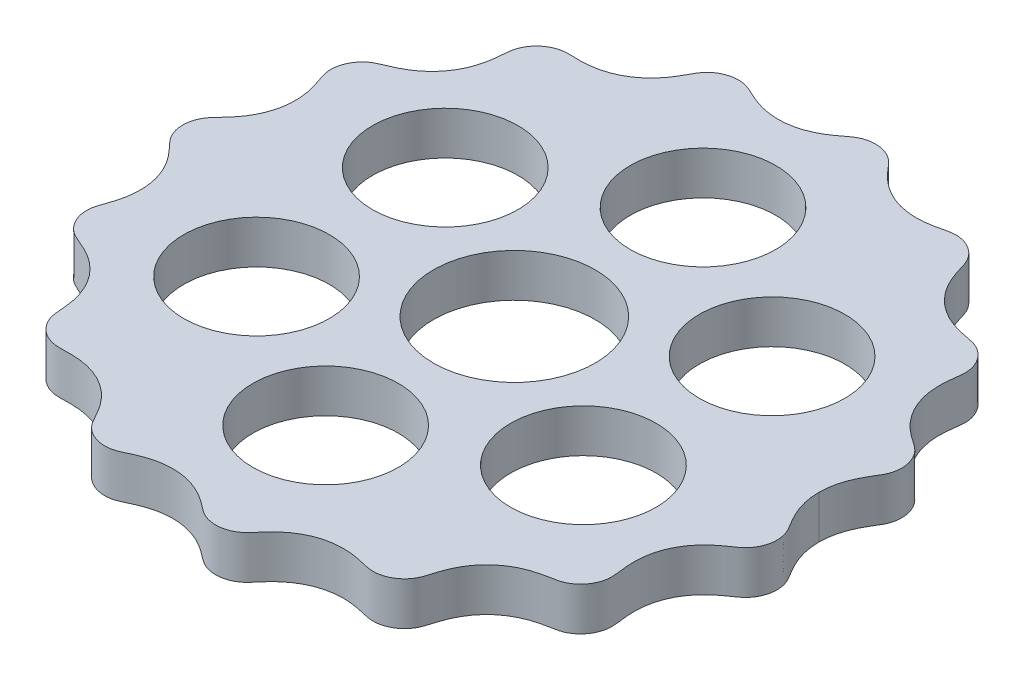
from build123d import *

# Parameters (mm, degrees)
SKETCH3_R           = 6.75
SKETCH3_R_2         = 7.5
BOSS_EXTRUDE1_DEPTH = 4


with BuildPart() as part:
    # Sketch3 → Boss-Extrude1 (new body)
    with BuildSketch(Plane(origin=(0, 0, 0), x_dir=(1, 0, 0), z_dir=(0, 1, 0))):
        with BuildLine():
            add(Edge.make_bspline(
                [(-29.5, 0), (-29.5, -0.020506856), (-29.499508775, -0.061726851), (-29.497298265, -0.132392574), (-29.491402713, -0.233802562), (-29.480345975, -0.355378471), (-29.461173363, -0.493251706), (-29.4301833, -0.65550882), (-29.382904352, -0.838786396), (-29.323765371, -1.017900193), (-29.252718115, -1.193085775), (-29.124632087, -1.45558278), (-28.90921809, -1.789990126), (-28.572215157, -2.159464513), (-28.153637798, -2.591986094), (-27.793312582, -3.00332682), (-27.494220956, -3.391733715), (-27.198539155, -3.829853606), (-26.916327948, -4.321772504), (-26.643471264, -4.925378903), (-26.417456605, -5.641378167), (-26.279232637, -6.372836761), (-26.22782757, -7.109204715), (-26.260469314, -7.840015999), (-26.36609006, -8.521461383), (-26.524712227, -9.148060531), (-26.7122212, -9.722867749), (-26.906402138, -10.249106449), (-27.084026477, -10.828826935), (-27.128243584, -11.480242215), (-27.007624154, -12.169804958), (-26.704339817, -12.853660239), (-26.26540634, -13.416119), (-25.727125692, -13.831132821), (-25.147809675, -14.089945054), (-24.599023965, -14.309950779), (-24.022947843, -14.572402127), (-23.433895979, -14.896684969), (-22.846116736, -15.301115548), (-22.2782997, -15.795828927), (-21.775456582, -16.351104338), (-21.344557209, -16.958202197), (-20.98980086, -17.607953023), (-20.713792994, -18.28975274), (-20.525586467, -18.958866797), (-20.409546628, -19.601777164), (-20.343616085, -20.211251037), (-20.305698303, -20.780679307), (-20.23664741, -21.391293307), (-20.015074466, -22.012995768), (-19.625837334, -22.598145566), (-19.074505483, -23.101552224), (-18.450372779, -23.438648125), (-17.79766419, -23.604101232), (-17.168808068, -23.610430078), (-16.583442648, -23.587314002), (-15.956229893, -23.590396394), (-15.292028768, -23.642107021), (-14.595998502, -23.765832809), (-13.88061938, -23.977927385), (-13.194493936, -24.272282169), (-12.548165998, -24.645439778), (-11.950184555, -25.092464451), (-11.408815704, -25.605953656), (-10.953650895, -26.146870654), (-10.576767616, -26.696230387), (-10.260491808, -27.237871371), (-9.987828208, -27.756370733), (-9.667919205, -28.297811687), (-9.198278317, -28.780347353), (-8.594278351, -29.15231418), (-7.882649472, -29.378078239), (-7.181276314, -29.422592585), (-6.532079721, -29.303629152), (-5.968747032, -29.058121981), (-5.456648804, -28.806245606), (-4.895863657, -28.558606199), (-4.281067062, -28.337644457), (-3.607493969, -28.166079072), (-2.879034252, -28.064209022), (-2.138955211, -28.046561644), (-1.397743593, -28.116182477), (-0.66543903, -28.274019755), (0.046903188, -28.518406928), (0.691041037, -28.825223584), (1.266402425, -29.173215737), (1.781732794, -29.540887108), (2.246651709, -29.906145821), (2.760454369, -30.27844327), (3.38899707, -30.537099289), (4.095583639, -30.636000314), (4.839435928, -30.556720046), (5.496965868, -30.316405455), (6.038931991, -29.952392783), (6.45228992, -29.50872604), (6.810708629, -29.077401095), (7.154069437, -28.695657759), (7.481579097, -28.367944206), (7.791280828, -28.092219953), (8.075855138, -27.863479964), (8.446794063, -27.597140689), (8.914400316, -27.31099678), (9.495575967, -27.027420956), (10.198128539, -26.78142275), (10.931287881, -26.619125576), (11.684458703, -26.544316545), (12.403190484, -26.556062439), (13.077925596, -26.635361227), (13.707268128, -26.76047143), (14.290611017, -26.906273022), (14.918614525, -27.044392858), (15.605165751, -27.030879963), (16.302610967, -26.834433706), (16.962995745, -26.453160111), (17.481845811, -25.947378552), (17.836824154, -25.359563266), (18.031210068, -24.746637991), (18.196614764, -24.168544426), (18.402935315, -23.560968071), (18.671631778, -22.936971669), (19.020819266, -22.308674205), (19.462201082, -21.693788885), (19.969318303, -21.140042744), (20.533661927, -20.654546757), (21.145635648, -20.241997885), (21.713789444, -19.946736544), (22.221250647, -19.739640946), (22.701549759, -19.580730556), (23.149147383, -19.460869188), (23.651405896, -19.354435046), (24.20416515, -19.259668921), (24.795065003, -19.123538297), (25.381295585, -18.836179949), (25.918177073, -18.386904665), (26.35876322, -17.782346644), (26.62640489, -17.120976223), (26.716674088, -16.447312982), (26.651155977, -15.816199005), (26.567292453, -15.230937345), (26.50654453, -14.600813106), (26.492855654, -13.928538721), (26.549212855, -13.217291653), (26.693739537, -12.478190143), (26.923199049, -11.765079402), (27.233514149, -11.088357289), (27.618832314, -10.456259632), (28.071291676, -9.87632012), (28.55664588, -9.3787878), (29.055422495, -8.956812811), (29.550245165, -8.59502081), (30.024477359, -8.2774), (30.518681828, -7.912396516), (30.946423484, -7.409498164), (31.248335855, -6.800339452), (31.405725242, -6.117189546), (31.406093828, -5.378461077), (31.237194706, -4.727278247), (30.934069136, -4.194030434), (30.612620381, -3.677587615), (30.33495462, -3.200835277), (30.102039584, -2.734864508), (29.915742198, -2.279302585), (29.785086374, -1.891206047), (29.695940045, -1.57589139), (29.625712231, -1.26893095), (29.572667516, -0.972896461), (29.539534103, -0.719877503), (29.520033852, -0.516003517), (29.508769472, -0.345716178), (29.502757018, -0.199994007), (29.500501274, -0.089793684), (29.5, -0.029889461), (29.5, 0.029889461), (29.500501274, 0.089793684), (29.502757018, 0.199994007), (29.508769472, 0.345716178), (29.520033852, 0.516003517), (29.539534103, 0.719877503), (29.572667516, 0.972896461), (29.625712231, 1.26893095), (29.695940045, 1.57589139), (29.785086374, 1.891206047), (29.915742198, 2.279302585), (30.102039584, 2.734864508), (30.33495462, 3.200835277), (30.612620381, 3.677587615), (30.934069136, 4.194030434), (31.237194706, 4.727278247), (31.406093828, 5.378461077), (31.405725242, 6.117189546), (31.248335855, 6.800339452), (30.946423484, 7.409498164), (30.518681828, 7.912396516), (30.024477359, 8.2774), (29.550245165, 8.59502081), (29.055422495, 8.956812811), (28.55664588, 9.3787878), (28.071291676, 9.87632012), (27.618832314, 10.456259632), (27.233514149, 11.088357289), (26.923199049, 11.765079402), (26.693739537, 12.478190143), (26.549212855, 13.217291653), (26.492855654, 13.928538721), (26.50654453, 14.600813106), (26.567292453, 15.230937345), (26.651155977, 15.816199005), (26.716674088, 16.447312982), (26.62640489, 17.120976223), (26.35876322, 17.782346644), (25.918177073, 18.386904665), (25.381295585, 18.836179949), (24.795065003, 19.123538297), (24.20416515, 19.259668921), (23.651405896, 19.354435046), (23.149147383, 19.460869188), (22.701549759, 19.580730556), (22.221250647, 19.739640946), (21.713789444, 19.946736544), (21.145635648, 20.241997885), (20.533661927, 20.654546757), (19.969318303, 21.140042744), (19.462201082, 21.693788885), (19.020819266, 22.308674205), (18.671631778, 22.936971669), (18.402935315, 23.560968071), (18.196614764, 24.168544426), (18.031210068, 24.746637991), (17.836824154, 25.359563266), (17.481845811, 25.947378552), (16.962995745, 26.453160111), (16.302610967, 26.834433706), (15.605165751, 27.030879963), (14.918614525, 27.044392858), (14.290611017, 26.906273022), (13.707268128, 26.76047143), (13.077925596, 26.635361227), (12.403190484, 26.556062439), (11.684458703, 26.544316545), (10.931287881, 26.619125576), (10.198128539, 26.78142275), (9.495575967, 27.027420956), (8.914400316, 27.31099678), (8.446794063, 27.597140689), (8.075855138, 27.863479964), (7.791280828, 28.092219953), (7.481579097, 28.367944206), (7.154069437, 28.695657759), (6.810708629, 29.077401095), (6.45228992, 29.50872604), (6.038931991, 29.952392783), (5.496965868, 30.316405455), (4.839435928, 30.556720046), (4.095583639, 30.636000314), (3.38899707, 30.537099289), (2.760454369, 30.27844327), (2.246651709, 29.906145821), (1.781732794, 29.540887108), (1.266402425, 29.173215737), (0.691041037, 28.825223584), (0.046903188, 28.518406928), (-0.66543903, 28.274019755), (-1.397743593, 28.116182477), (-2.138955211, 28.046561644), (-2.879034252, 28.064209022), (-3.607493969, 28.166079072), (-4.281067062, 28.337644457), (-4.895863657, 28.558606199), (-5.456648804, 28.806245606), (-5.968747032, 29.058121981), (-6.532079721, 29.303629152), (-7.181276314, 29.422592585), (-7.882649472, 29.378078239), (-8.594278351, 29.15231418), (-9.198278317, 28.780347353), (-9.667919205, 28.297811687), (-9.987828208, 27.756370733), (-10.260491808, 27.237871371), (-10.576767616, 26.696230387), (-10.953650895, 26.146870654), (-11.408815704, 25.605953656), (-11.950184555, 25.092464451), (-12.548165998, 24.645439778), (-13.194493936, 24.272282169), (-13.88061938, 23.977927385), (-14.595998502, 23.765832809), (-15.292028768, 23.642107021), (-15.956229893, 23.590396394), (-16.583442648, 23.587314002), (-17.168808068, 23.610430078), (-17.79766419, 23.604101232), (-18.450372779, 23.438648125), (-19.074505483, 23.101552224), (-19.625837334, 22.598145566), (-20.015074466, 22.012995768), (-20.23664741, 21.391293307), (-20.305698303, 20.780679307), (-20.343616085, 20.211251037), (-20.409546628, 19.601777164), (-20.525586467, 18.958866797), (-20.713792994, 18.28975274), (-20.98980086, 17.607953023), (-21.344557209, 16.958202197), (-21.775456582, 16.351104338), (-22.2782997, 15.795828927), (-22.846116736, 15.301115548), (-23.433895979, 14.896684969), (-24.022947843, 14.572402127), (-24.599023965, 14.309950779), (-25.147809675, 14.089945054), (-25.727125692, 13.831132821), (-26.26540634, 13.416119), (-26.704339817, 12.853660239), (-27.007624154, 12.169804958), (-27.128243584, 11.480242215), (-27.084026477, 10.828826935), (-26.906402138, 10.249106449), (-26.7122212, 9.722867749), (-26.524712227, 9.148060531), (-26.36609006, 8.521461383), (-26.260469314, 7.840015999), (-26.22782757, 7.109204715), (-26.279232637, 6.372836761), (-26.417456605, 5.641378167), (-26.643471264, 4.925378903), (-26.916327948, 4.321772504), (-27.198539155, 3.829853606), (-27.494220956, 3.391733715), (-27.793312582, 3.00332682), (-28.153637798, 2.591986094), (-28.572215157, 2.159464513), (-28.90921809, 1.789990126), (-29.124632087, 1.45558278), (-29.252718115, 1.193085775), (-29.323765371, 1.017900193), (-29.382904352, 0.838786396), (-29.4301833, 0.65550882), (-29.461173363, 0.493251706), (-29.480345975, 0.355378471), (-29.491402713, 0.233802562), (-29.497298265, 0.132392574), (-29.499508775, 0.061726851), (-29.5, 0.020506856), (-29.5, 0)],
                knots=[0.063267729, 0.063267729, 0.063267729, 0.063267729, 0.063267729, 0.064073087, 0.064878445, 0.065683803, 0.066489161, 0.068099877, 0.069710593, 0.071321308, 0.072932024, 0.07454274, 0.076153456, 0.081294592, 0.086435729, 0.091576865, 0.096718001, 0.099941099, 0.103164197, 0.109610393, 0.116056589, 0.122502786, 0.128734391, 0.134965996, 0.141197601, 0.147429206, 0.152223902, 0.157018598, 0.161813294, 0.16660799, 0.172838223, 0.179068456, 0.185479405, 0.191890354, 0.196945124, 0.201999895, 0.207054665, 0.212109435, 0.218523879, 0.224938323, 0.231352767, 0.237767211, 0.24403289, 0.250298568, 0.256564247, 0.262829925, 0.267708243, 0.272586562, 0.277464881, 0.282343199, 0.288606193, 0.294869187, 0.301221536, 0.307573885, 0.312582328, 0.317590771, 0.322599213, 0.327607656, 0.333963549, 0.340319443, 0.346675336, 0.353031229, 0.359387122, 0.365743016, 0.372098909, 0.378454802, 0.383463245, 0.388471688, 0.393480131, 0.398488574, 0.404840922, 0.411193271, 0.417456265, 0.423719259, 0.428597578, 0.433475896, 0.438354215, 0.443232533, 0.449498212, 0.45576389, 0.462029568, 0.468295247, 0.474709691, 0.481124135, 0.487538579, 0.493953023, 0.499007793, 0.504062563, 0.509117334, 0.514172104, 0.520583053, 0.526994002, 0.533224235, 0.539454468, 0.544249164, 0.54904386, 0.553838556, 0.558633252, 0.561749055, 0.564864857, 0.56798066, 0.571096462, 0.577328068, 0.583559673, 0.590005869, 0.596452065, 0.602898261, 0.609344457, 0.614485594, 0.61962673, 0.624767866, 0.629909002, 0.636351866, 0.642794729, 0.649237593, 0.655680457, 0.660821593, 0.665962729, 0.671103865, 0.676245001, 0.682691197, 0.689137394, 0.69558359, 0.702029786, 0.708261391, 0.714492996, 0.720724602, 0.723840404, 0.726956207, 0.731750903, 0.736545599, 0.741340294, 0.74613499, 0.752365224, 0.758595457, 0.765006406, 0.771417355, 0.776472125, 0.781526895, 0.786581666, 0.791636436, 0.79805088, 0.804465324, 0.810879768, 0.817294212, 0.82355989, 0.829825569, 0.836091247, 0.842356925, 0.847235244, 0.852113562, 0.856991881, 0.8618702, 0.868133194, 0.874396188, 0.879984704, 0.885573221, 0.893186908, 0.896993752, 0.900800595, 0.906392324, 0.911984052, 0.914779916, 0.91757578, 0.920371644, 0.923167508, 0.925515183, 0.927862858, 0.929036695, 0.930210533, 0.93138437, 0.932558208, 0.932558208, 0.932558208, 0.933732045, 0.934905883, 0.93607972, 0.937253557, 0.939601232, 0.941948907, 0.944744771, 0.947540635, 0.950336499, 0.953132363, 0.958724092, 0.96431582, 0.968122663, 0.971929507, 0.979543194, 0.985131711, 0.990720228, 0.996983222, 1.003246216, 1.008124534, 1.013002853, 1.017881171, 1.02275949, 1.029025168, 1.035290847, 1.041556525, 1.047822203, 1.054236647, 1.060651091, 1.067065535, 1.073479979, 1.07853475, 1.08358952, 1.08864429, 1.093699061, 1.10011001, 1.106520959, 1.112751192, 1.118981425, 1.123776121, 1.128570817, 1.133365513, 1.138160209, 1.141276011, 1.144391814, 1.150623419, 1.156855024, 1.163086629, 1.169532826, 1.175979022, 1.182425218, 1.188871414, 1.19401255, 1.199153686, 1.204294823, 1.209435959, 1.215878822, 1.222321686, 1.22876455, 1.235207413, 1.240348549, 1.245489686, 1.250630822, 1.255771958, 1.262218154, 1.26866435, 1.275110546, 1.281556743, 1.287788348, 1.294019953, 1.297135756, 1.300251558, 1.303367361, 1.306483163, 1.311277859, 1.316072555, 1.320867251, 1.325661947, 1.33189218, 1.338122413, 1.344533362, 1.350944311, 1.355999082, 1.361053852, 1.366108622, 1.371163393, 1.377577837, 1.383992281, 1.390406725, 1.396821169, 1.403086847, 1.409352525, 1.415618204, 1.421883882, 1.426762201, 1.431640519, 1.436518838, 1.441397156, 1.44766015, 1.453923144, 1.460275493, 1.466627842, 1.471636285, 1.476644728, 1.481653171, 1.486661613, 1.493017507, 1.4993734, 1.505729293, 1.512085186, 1.518441079, 1.524796973, 1.531152866, 1.537508759, 1.542517202, 1.547525645, 1.552534088, 1.557542531, 1.563894879, 1.570247228, 1.576510222, 1.582773216, 1.587651535, 1.592529853, 1.597408172, 1.60228649, 1.608552169, 1.614817847, 1.621083526, 1.627349204, 1.633763648, 1.640178092, 1.646592536, 1.65300698, 1.65806175, 1.663116521, 1.668171291, 1.673226061, 1.67963701, 1.686047959, 1.692278192, 1.698508425, 1.703303121, 1.708097817, 1.712892513, 1.717687209, 1.723918814, 1.730150419, 1.736382025, 1.74261363, 1.749059826, 1.755506022, 1.761952218, 1.765175316, 1.768398415, 1.773539551, 1.778680687, 1.783821823, 1.788962959, 1.790573675, 1.792184391, 1.793795107, 1.795405823, 1.797016539, 1.798627255, 1.799432613, 1.800237971, 1.801043329, 1.801848686, 1.801848686, 1.801848686, 1.801848686, 1.801848686], degree=4))
        make_face()
        with Locations((16.405444566, -8.75)):
            Circle(SKETCH3_R, mode=Mode.SUBTRACT)
        with Locations((1.25, -17.5)):
            Circle(SKETCH3_R, mode=Mode.SUBTRACT)
        with Locations((-13.905444566, -8.75)):
            Circle(SKETCH3_R, mode=Mode.SUBTRACT)
        with Locations((-13.905444566, 8.75)):
            Circle(SKETCH3_R, mode=Mode.SUBTRACT)
        with Locations((1.25, 17.5)):
            Circle(SKETCH3_R, mode=Mode.SUBTRACT)
        with Locations((16.405444566, 8.75)):
            Circle(SKETCH3_R, mode=Mode.SUBTRACT)
        with Locations((1.25, 0)):
            Circle(SKETCH3_R_2, mode=Mode.SUBTRACT)
    extrude(amount=BOSS_EXTRUDE1_DEPTH)


solid = part.part
